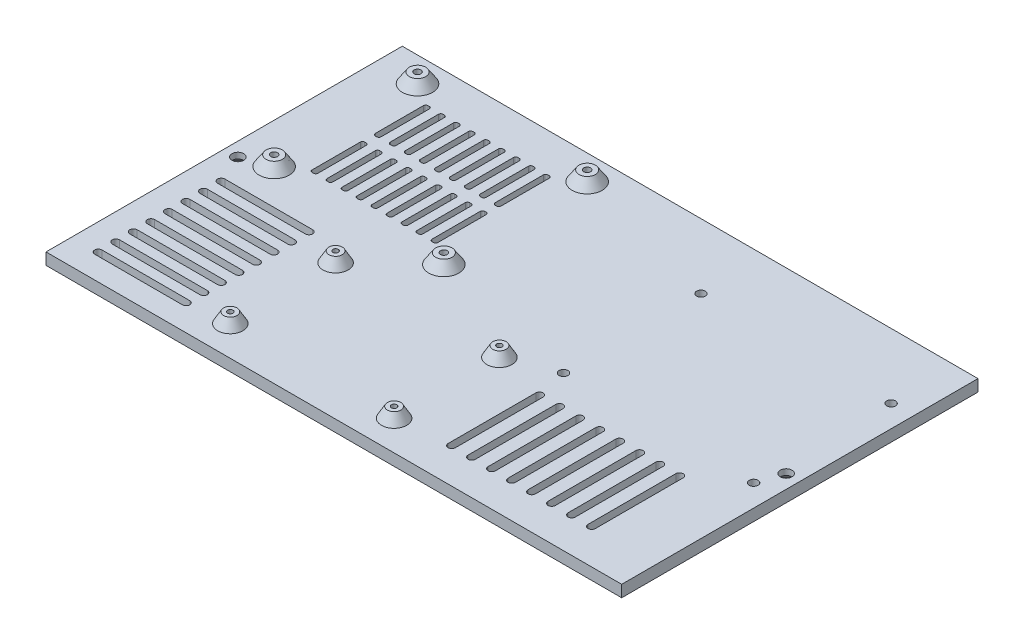
from build123d import *

# Parameters (mm, degrees)
SKETCH1_W                                            = 196.8
SKETCH1_H                                            = 121.8
BOSS_EXTRUDE1_DEPTH                                  = 4
SKETCH2_R                                            = 2
CUT_EXTRUDE1_DEPTH                                   = 116.790198203
CSK_FOR_M4_HEX_SOCKET_COUNTERSUNK_HEAD_S_D           = 4
CSK_FOR_M4_HEX_SOCKET_COUNTERSUNK_HEAD_S_CSINK_D     = 8
CSK_FOR_M4_HEX_SOCKET_COUNTERSUNK_HEAD_S_CSINK_ANGLE = 90
SKETCH6_R                                            = 2.75
BOSS_EXTRUDE3_DEPTH                                  = 3.5
CHAMFER1_SIZE                                        = 2.4
CHAMFER1_SIZE_2                                      = 3.558146324
SKETCH7_R                                            = 1.16
CUT_EXTRUDE2_DEPTH                                   = 6.5
SKETCH8_R                                            = 2.25
BOSS_EXTRUDE4_DEPTH                                  = 3.5
CHAMFER2_SIZE                                        = 2.05
CHAMFER2_SIZE_2                                      = 3.550704156
SKETCH9_R                                            = 0.93
CUT_EXTRUDE3_DEPTH                                   = 6.5
SKETCH10_R                                           = 1.5
CUT_EXTRUDE4_DEPTH                                   = 116.790198203
CUT_EXTRUDE5_DEPTH                                   = 116.790198203
CUT_EXTRUDE6_DEPTH                                   = 116.790198203
CUT_EXTRUDE7_DEPTH                                   = 116.790198203


with BuildPart() as part:
    # Sketch1 → Boss-Extrude1 (new body)
    with BuildSketch(Plane(origin=(0, 0, 0), x_dir=(1, 0, 0), z_dir=(0, 1, 0))):
        Rectangle(SKETCH1_W, SKETCH1_H)
    extrude(amount=BOSS_EXTRUDE1_DEPTH)

    # Sketch2 → Cut-Extrude1 (cut, symmetric)
    with BuildSketch(Plane(origin=(0, 0, 0), x_dir=(-1, 0, 0), z_dir=(0, -1, 0))):
        with Locations(Location((93.7, 0, 0), (0, 0, 90))):
            Circle(SKETCH2_R)
    cut_extrude1 = extrude(amount=CUT_EXTRUDE1_DEPTH, both=True, mode=Mode.SUBTRACT)

    # CSK for M4 Hex Socket Countersunk Head Screw3 (through all)
    with Locations(Plane(origin=(-93.7, 0, 0), x_dir=(0, 0, -1), z_dir=(0, -1, 0))):
        with Locations((0, 0)):
            csk_for_m4_hex_socket_countersunk_head_s = CounterSinkHole(CSK_FOR_M4_HEX_SOCKET_COUNTERSUNK_HEAD_S_D / 2, CSK_FOR_M4_HEX_SOCKET_COUNTERSUNK_HEAD_S_CSINK_D / 2, counter_sink_angle=CSK_FOR_M4_HEX_SOCKET_COUNTERSUNK_HEAD_S_CSINK_ANGLE)

    # Mirror1: Cut-Extrude1, CSK for M4 Hex Socket Countersunk Head Screw3 across plane
    add(cut_extrude1.mirror(Plane(origin=(0, 0, 0), x_dir=(0, 0, 1), z_dir=(1, 0, 0))), mode=Mode.SUBTRACT)
    add(csk_for_m4_hex_socket_countersunk_head_s.mirror(Plane(origin=(0, 0, 0), x_dir=(0, 0, 1), z_dir=(1, 0, 0))), mode=Mode.SUBTRACT)

    # Sketch6 → Boss-Extrude3 (add)
    with BuildSketch(Plane(origin=(0, 4, 0), x_dir=(1, 0, 0), z_dir=(0, 1, 0))):
        with Locations(Location((-26.7, 3.4, 0), (0, 0, 270))):
            Circle(SKETCH6_R)
        with Locations(Location((-84.7, 3.4, 0), (0, 0, 270))):
            Circle(SKETCH6_R)
        with Locations(Location((-26.7, 52.4, 0), (0, 0, 270))):
            Circle(SKETCH6_R)
        with Locations(Location((-84.7, 52.4, 0), (0, 0, 270))):
            Circle(SKETCH6_R)
    extrude(amount=BOSS_EXTRUDE3_DEPTH)

    # Chamfer1
    # the kernel refuses this chamfer: 3.558146324, 2.4 mm, written as the material it adds along each edge
    with BuildSketch(Plane(origin=(-84.7, 4, -52.4), x_dir=(0, 0, 1), z_dir=(-1, 0, 0))) as chamfer1_piece_1_section:
        Polygon((2.75 + CHAMFER1_SIZE, 0), (2.75, CHAMFER1_SIZE_2), (2.75, 0), align=None)
    chamfer1_piece_1 = revolve(axis=Axis((-84.7, 4, -52.4), (0, 1, 0)), mode=Mode.PRIVATE)
    chamfer1_piece_1 = split(chamfer1_piece_1, bisect_by=Plane(origin=(-84.7, 7.5, -56.370171739), z_dir=(0, -1, 0)), keep=Keep.TOP, mode=Mode.PRIVATE)
    add(chamfer1_piece_1)
    with BuildSketch(Plane(origin=(-26.7, 4, -52.4), x_dir=(0, 0, 1), z_dir=(-1, 0, 0))) as chamfer1_piece_2_section:
        Polygon((2.75 + CHAMFER1_SIZE, 0), (2.75, CHAMFER1_SIZE_2), (2.75, 0), align=None)
    chamfer1_piece_2 = revolve(axis=Axis((-26.7, 4, -52.4), (0, 1, 0)), mode=Mode.PRIVATE)
    chamfer1_piece_2 = split(chamfer1_piece_2, bisect_by=Plane(origin=(-26.7, 7.5, -56.370171737), z_dir=(0, -1, 0)), keep=Keep.TOP, mode=Mode.PRIVATE)
    add(chamfer1_piece_2)
    with BuildSketch(Plane(origin=(-84.7, 4, -3.4), x_dir=(0, 0, 1), z_dir=(-1, 0, 0))) as chamfer1_piece_3_section:
        Polygon((2.75 + CHAMFER1_SIZE, 0), (2.75, CHAMFER1_SIZE_2), (2.75, 0), align=None)
    chamfer1_piece_3 = revolve(axis=Axis((-84.7, 4, -3.4), (0, 1, 0)), mode=Mode.PRIVATE)
    chamfer1_piece_3 = split(chamfer1_piece_3, bisect_by=Plane(origin=(-84.7, 7.5, -7.370171739), z_dir=(0, -1, 0)), keep=Keep.TOP, mode=Mode.PRIVATE)
    add(chamfer1_piece_3)
    with BuildSketch(Plane(origin=(-26.7, 4, -3.4), x_dir=(0, 0, 1), z_dir=(-1, 0, 0))) as chamfer1_piece_4_section:
        Polygon((2.75 + CHAMFER1_SIZE, 0), (2.75, CHAMFER1_SIZE_2), (2.75, 0), align=None)
    chamfer1_piece_4 = revolve(axis=Axis((-26.7, 4, -3.4), (0, 1, 0)), mode=Mode.PRIVATE)
    chamfer1_piece_4 = split(chamfer1_piece_4, bisect_by=Plane(origin=(-26.7, 7.5, -7.370171738), z_dir=(0, -1, 0)), keep=Keep.TOP, mode=Mode.PRIVATE)
    add(chamfer1_piece_4)

    # Sketch7 → Cut-Extrude2 (cut)
    with BuildSketch(Plane(origin=(0, 7.5, 0), x_dir=(1, 0, 0), z_dir=(0, 1, 0))):
        with Locations(Location((-26.7, 3.4, 0), (0, 0, 270))):
            Circle(SKETCH7_R)
        with Locations(Location((-26.7, 52.4, 0), (0, 0, 270))):
            Circle(SKETCH7_R)
        with Locations(Location((-84.7, 52.4, 0), (0, 0, 270))):
            Circle(SKETCH7_R)
        with Locations(Location((-84.7, 3.4, 0), (0, 0, 270))):
            Circle(SKETCH7_R)
    extrude(amount=-CUT_EXTRUDE2_DEPTH, mode=Mode.SUBTRACT)

    # Sketch8 → Boss-Extrude4 (add)
    with BuildSketch(Plane(origin=(0, 4, 0), x_dir=(1, 0, 0), z_dir=(0, 1, 0))):
        with Locations(Location((-45.7, -14.6, 0), (0, 0, 270))):
            Circle(SKETCH8_R)
        with Locations(Location((10.3, -14.6, 0), (0, 0, 270))):
            Circle(SKETCH8_R)
        with Locations(Location((10.3, -50.6, 0), (0, 0, 270))):
            Circle(SKETCH8_R)
        with Locations(Location((-45.7, -50.6, 0), (0, 0, 270))):
            Circle(SKETCH8_R)
    extrude(amount=BOSS_EXTRUDE4_DEPTH)

    # Chamfer2
    # the kernel refuses this chamfer: 3.550704156, 2.05 mm, written as the material it adds along each edge
    with BuildSketch(Plane(origin=(10.3, 4, 14.6), x_dir=(0, 0, 1), z_dir=(-1, 0, 0))) as chamfer2_piece_1_section:
        Polygon((2.25 + CHAMFER2_SIZE, 0), (2.25, CHAMFER2_SIZE_2), (2.25, 0), align=None)
    chamfer2_piece_1 = revolve(axis=Axis((10.3, 4, 14.6), (0, 1, 0)), mode=Mode.PRIVATE)
    chamfer2_piece_1 = split(chamfer2_piece_1, bisect_by=Plane(origin=(10.3, 7.5, 11.311409997), z_dir=(0, -1, 0)), keep=Keep.TOP, mode=Mode.PRIVATE)
    add(chamfer2_piece_1)
    with BuildSketch(Plane(origin=(10.3, 4, 50.6), x_dir=(0, 0, 1), z_dir=(-1, 0, 0))) as chamfer2_piece_2_section:
        Polygon((2.25 + CHAMFER2_SIZE, 0), (2.25, CHAMFER2_SIZE_2), (2.25, 0), align=None)
    chamfer2_piece_2 = revolve(axis=Axis((10.3, 4, 50.6), (0, 1, 0)), mode=Mode.PRIVATE)
    chamfer2_piece_2 = split(chamfer2_piece_2, bisect_by=Plane(origin=(10.3, 7.5, 47.311409996), z_dir=(0, -1, 0)), keep=Keep.TOP, mode=Mode.PRIVATE)
    add(chamfer2_piece_2)
    with BuildSketch(Plane(origin=(-45.7, 4, 50.6), x_dir=(0, 0, 1), z_dir=(-1, 0, 0))) as chamfer2_piece_3_section:
        Polygon((2.25 + CHAMFER2_SIZE, 0), (2.25, CHAMFER2_SIZE_2), (2.25, 0), align=None)
    chamfer2_piece_3 = revolve(axis=Axis((-45.7, 4, 50.6), (0, 1, 0)), mode=Mode.PRIVATE)
    chamfer2_piece_3 = split(chamfer2_piece_3, bisect_by=Plane(origin=(-45.7, 7.5, 47.311409996), z_dir=(0, -1, 0)), keep=Keep.TOP, mode=Mode.PRIVATE)
    add(chamfer2_piece_3)
    with BuildSketch(Plane(origin=(-45.7, 4, 14.6), x_dir=(0, 0, 1), z_dir=(-1, 0, 0))) as chamfer2_piece_4_section:
        Polygon((2.25 + CHAMFER2_SIZE, 0), (2.25, CHAMFER2_SIZE_2), (2.25, 0), align=None)
    chamfer2_piece_4 = revolve(axis=Axis((-45.7, 4, 14.6), (0, 1, 0)), mode=Mode.PRIVATE)
    chamfer2_piece_4 = split(chamfer2_piece_4, bisect_by=Plane(origin=(-45.7, 7.5, 11.311409996), z_dir=(0, -1, 0)), keep=Keep.TOP, mode=Mode.PRIVATE)
    add(chamfer2_piece_4)

    # Sketch9 → Cut-Extrude3 (cut)
    with BuildSketch(Plane(origin=(0, 7.5, 0), x_dir=(1, 0, 0), z_dir=(0, 1, 0))):
        with Locations(Location((-45.7, -14.6, 0), (0, 0, 270))):
            Circle(SKETCH9_R)
        with Locations(Location((10.3, -14.6, 0), (0, 0, 270))):
            Circle(SKETCH9_R)
        with Locations(Location((10.3, -50.6, 0), (0, 0, 270))):
            Circle(SKETCH9_R)
        with Locations(Location((-45.7, -50.6, 0), (0, 0, 270))):
            Circle(SKETCH9_R)
    extrude(amount=-CUT_EXTRUDE3_DEPTH, mode=Mode.SUBTRACT)

    # Sketch10 → Cut-Extrude4 (cut, through all)
    with BuildSketch(Plane(origin=(0, 4, 0), x_dir=(1, 0, 0), z_dir=(0, 1, 0))):
        with Locations(Location((25.9, 38.7, 0), (0, 0, 270))):
            Circle(SKETCH10_R)
        with Locations(Location((25.9, -8.3, 0), (0, 0, 270))):
            Circle(SKETCH10_R)
        with Locations(Location((90.9, -8.3, 0), (0, 0, 270))):
            Circle(SKETCH10_R)
        with Locations(Location((90.9, 38.7, 0), (0, 0, 270))):
            Circle(SKETCH10_R)
    extrude(amount=-CUT_EXTRUDE4_DEPTH, mode=Mode.SUBTRACT)

    # Sketch11 → Cut-Extrude5 (cut, through all)
    with BuildSketch(Plane(origin=(0, 4, 0), x_dir=(1, 0, 0), z_dir=(0, 1, 0))):
        with BuildLine():
            Line((-76.45, 47.7), (-75.95, 47.7))
            ThreePointArc((-75.95, 47.7), (-75.419669914, 47.480330086), (-75.2, 46.95))
            Line((-75.2, 46.95), (-75.2, 30.45))
            ThreePointArc((-75.2, 30.45), (-75.419669914, 29.919669914), (-75.95, 29.7))
            Line((-75.95, 29.7), (-76.45, 29.7))
            ThreePointArc((-76.45, 29.7), (-76.980330086, 29.919669914), (-77.2, 30.45))
            Line((-77.2, 30.45), (-77.2, 46.95))
            ThreePointArc((-77.2, 46.95), (-76.980330086, 47.480330086), (-76.45, 47.7))
        make_face()
        with BuildLine():
            Line((-72.075, 46.95), (-72.075, 30.45))
            ThreePointArc((-72.075, 30.45), (-71.855330086, 29.919669914), (-71.325, 29.7))
            Line((-71.325, 29.7), (-70.825, 29.7))
            ThreePointArc((-70.825, 29.7), (-70.294669914, 29.919669914), (-70.075, 30.45))
            Line((-70.075, 30.45), (-70.075, 46.95))
            ThreePointArc((-70.075, 46.95), (-70.294669914, 47.480330086), (-70.825, 47.7))
            Line((-70.825, 47.7), (-71.325, 47.7))
            ThreePointArc((-71.325, 47.7), (-71.855330086, 47.480330086), (-72.075, 46.95))
        make_face()
        with BuildLine():
            Line((-66.95, 46.95), (-66.95, 30.45))
            ThreePointArc((-66.95, 30.45), (-66.730330086, 29.919669914), (-66.2, 29.7))
            Line((-66.2, 29.7), (-65.7, 29.7))
            ThreePointArc((-65.7, 29.7), (-65.169669914, 29.919669914), (-64.95, 30.45))
            Line((-64.95, 30.45), (-64.95, 46.95))
            ThreePointArc((-64.95, 46.95), (-65.169669914, 47.480330086), (-65.7, 47.7))
            Line((-65.7, 47.7), (-66.2, 47.7))
            ThreePointArc((-66.2, 47.7), (-66.730330086, 47.480330086), (-66.95, 46.95))
        make_face()
        with BuildLine():
            Line((-61.825, 46.95), (-61.825, 30.45))
            ThreePointArc((-61.825, 30.45), (-61.605330086, 29.919669914), (-61.075, 29.7))
            Line((-61.075, 29.7), (-60.575, 29.7))
            ThreePointArc((-60.575, 29.7), (-60.044669914, 29.919669914), (-59.825, 30.45))
            Line((-59.825, 30.45), (-59.825, 46.95))
            ThreePointArc((-59.825, 46.95), (-60.044669914, 47.480330086), (-60.575, 47.7))
            Line((-60.575, 47.7), (-61.075, 47.7))
            ThreePointArc((-61.075, 47.7), (-61.605330086, 47.480330086), (-61.825, 46.95))
        make_face()
        with BuildLine():
            Line((-56.7, 46.95), (-56.7, 30.45))
            ThreePointArc((-56.7, 30.45), (-56.480330086, 29.919669914), (-55.95, 29.7))
            Line((-55.95, 29.7), (-55.45, 29.7))
            ThreePointArc((-55.45, 29.7), (-54.919669914, 29.919669914), (-54.7, 30.45))
            Line((-54.7, 30.45), (-54.7, 46.95))
            ThreePointArc((-54.7, 46.95), (-54.919669914, 47.480330086), (-55.45, 47.7))
            Line((-55.45, 47.7), (-55.95, 47.7))
            ThreePointArc((-55.95, 47.7), (-56.480330086, 47.480330086), (-56.7, 46.95))
        make_face()
        with BuildLine():
            Line((-51.575, 46.95), (-51.575, 30.45))
            ThreePointArc((-51.575, 30.45), (-51.355330086, 29.919669914), (-50.825, 29.7))
            Line((-50.825, 29.7), (-50.325, 29.7))
            ThreePointArc((-50.325, 29.7), (-49.794669914, 29.919669914), (-49.575, 30.45))
            Line((-49.575, 30.45), (-49.575, 46.95))
            ThreePointArc((-49.575, 46.95), (-49.794669914, 47.480330086), (-50.325, 47.7))
            Line((-50.325, 47.7), (-50.825, 47.7))
            ThreePointArc((-50.825, 47.7), (-51.355330086, 47.480330086), (-51.575, 46.95))
        make_face()
        with BuildLine():
            Line((-46.45, 46.95), (-46.45, 30.45))
            ThreePointArc((-46.45, 30.45), (-46.230330086, 29.919669914), (-45.7, 29.7))
            Line((-45.7, 29.7), (-45.2, 29.7))
            ThreePointArc((-45.2, 29.7), (-44.669669914, 29.919669914), (-44.45, 30.45))
            Line((-44.45, 30.45), (-44.45, 46.95))
            ThreePointArc((-44.45, 46.95), (-44.669669914, 47.480330086), (-45.2, 47.7))
            Line((-45.2, 47.7), (-45.7, 47.7))
            ThreePointArc((-45.7, 47.7), (-46.230330086, 47.480330086), (-46.45, 46.95))
        make_face()
        with BuildLine():
            Line((-41.325, 46.95), (-41.325, 30.45))
            ThreePointArc((-41.325, 30.45), (-41.105330086, 29.919669914), (-40.575, 29.7))
            Line((-40.575, 29.7), (-40.075, 29.7))
            ThreePointArc((-40.075, 29.7), (-39.544669914, 29.919669914), (-39.325, 30.45))
            Line((-39.325, 30.45), (-39.325, 46.95))
            ThreePointArc((-39.325, 46.95), (-39.544669914, 47.480330086), (-40.075, 47.7))
            Line((-40.075, 47.7), (-40.575, 47.7))
            ThreePointArc((-40.575, 47.7), (-41.105330086, 47.480330086), (-41.325, 46.95))
        make_face()
        with BuildLine():
            Line((-36.2, 46.95), (-36.2, 30.45))
            ThreePointArc((-36.2, 30.45), (-35.980330086, 29.919669914), (-35.45, 29.7))
            Line((-35.45, 29.7), (-34.95, 29.7))
            ThreePointArc((-34.95, 29.7), (-34.419669914, 29.919669914), (-34.2, 30.45))
            Line((-34.2, 30.45), (-34.2, 46.95))
            ThreePointArc((-34.2, 46.95), (-34.419669914, 47.480330086), (-34.95, 47.7))
            Line((-34.95, 47.7), (-35.45, 47.7))
            ThreePointArc((-35.45, 47.7), (-35.980330086, 47.480330086), (-36.2, 46.95))
        make_face()
        with BuildLine():
            Line((-72.075, 25.35), (-72.075, 8.85))
            ThreePointArc((-72.075, 8.85), (-71.855330086, 8.319669914), (-71.325, 8.1))
            Line((-71.325, 8.1), (-70.825, 8.1))
            ThreePointArc((-70.825, 8.1), (-70.294669914, 8.319669914), (-70.075, 8.85))
            Line((-70.075, 8.85), (-70.075, 25.35))
            ThreePointArc((-70.075, 25.35), (-70.294669914, 25.880330086), (-70.825, 26.1))
            Line((-70.825, 26.1), (-71.325, 26.1))
            ThreePointArc((-71.325, 26.1), (-71.855330086, 25.880330086), (-72.075, 25.35))
        make_face()
        with BuildLine():
            Line((-66.95, 25.35), (-66.95, 8.85))
            ThreePointArc((-66.95, 8.85), (-66.730330086, 8.319669914), (-66.2, 8.1))
            Line((-66.2, 8.1), (-65.7, 8.1))
            ThreePointArc((-65.7, 8.1), (-65.169669914, 8.319669914), (-64.95, 8.85))
            Line((-64.95, 8.85), (-64.95, 25.35))
            ThreePointArc((-64.95, 25.35), (-65.169669914, 25.880330086), (-65.7, 26.1))
            Line((-65.7, 26.1), (-66.2, 26.1))
            ThreePointArc((-66.2, 26.1), (-66.730330086, 25.880330086), (-66.95, 25.35))
        make_face()
        with BuildLine():
            Line((-61.825, 25.35), (-61.825, 8.85))
            ThreePointArc((-61.825, 8.85), (-61.605330086, 8.319669914), (-61.075, 8.1))
            Line((-61.075, 8.1), (-60.575, 8.1))
            ThreePointArc((-60.575, 8.1), (-60.044669914, 8.319669914), (-59.825, 8.85))
            Line((-59.825, 8.85), (-59.825, 25.35))
            ThreePointArc((-59.825, 25.35), (-60.044669914, 25.880330086), (-60.575, 26.1))
            Line((-60.575, 26.1), (-61.075, 26.1))
            ThreePointArc((-61.075, 26.1), (-61.605330086, 25.880330086), (-61.825, 25.35))
        make_face()
        with BuildLine():
            Line((-56.7, 25.35), (-56.7, 8.85))
            ThreePointArc((-56.7, 8.85), (-56.480330086, 8.319669914), (-55.95, 8.1))
            Line((-55.95, 8.1), (-55.45, 8.1))
            ThreePointArc((-55.45, 8.1), (-54.919669914, 8.319669914), (-54.7, 8.85))
            Line((-54.7, 8.85), (-54.7, 25.35))
            ThreePointArc((-54.7, 25.35), (-54.919669914, 25.880330086), (-55.45, 26.1))
            Line((-55.45, 26.1), (-55.95, 26.1))
            ThreePointArc((-55.95, 26.1), (-56.480330086, 25.880330086), (-56.7, 25.35))
        make_face()
        with BuildLine():
            Line((-51.575, 25.35), (-51.575, 8.85))
            ThreePointArc((-51.575, 8.85), (-51.355330086, 8.319669914), (-50.825, 8.1))
            Line((-50.825, 8.1), (-50.325, 8.1))
            ThreePointArc((-50.325, 8.1), (-49.794669914, 8.319669914), (-49.575, 8.85))
            Line((-49.575, 8.85), (-49.575, 25.35))
            ThreePointArc((-49.575, 25.35), (-49.794669914, 25.880330086), (-50.325, 26.1))
            Line((-50.325, 26.1), (-50.825, 26.1))
            ThreePointArc((-50.825, 26.1), (-51.355330086, 25.880330086), (-51.575, 25.35))
        make_face()
        with BuildLine():
            Line((-46.45, 25.35), (-46.45, 8.85))
            ThreePointArc((-46.45, 8.85), (-46.230330086, 8.319669914), (-45.7, 8.1))
            Line((-45.7, 8.1), (-45.2, 8.1))
            ThreePointArc((-45.2, 8.1), (-44.669669914, 8.319669914), (-44.45, 8.85))
            Line((-44.45, 8.85), (-44.45, 25.35))
            ThreePointArc((-44.45, 25.35), (-44.669669914, 25.880330086), (-45.2, 26.1))
            Line((-45.2, 26.1), (-45.7, 26.1))
            ThreePointArc((-45.7, 26.1), (-46.230330086, 25.880330086), (-46.45, 25.35))
        make_face()
        with BuildLine():
            Line((-41.325, 25.35), (-41.325, 8.85))
            ThreePointArc((-41.325, 8.85), (-41.105330086, 8.319669914), (-40.575, 8.1))
            Line((-40.575, 8.1), (-40.075, 8.1))
            ThreePointArc((-40.075, 8.1), (-39.544669914, 8.319669914), (-39.325, 8.85))
            Line((-39.325, 8.85), (-39.325, 25.35))
            ThreePointArc((-39.325, 25.35), (-39.544669914, 25.880330086), (-40.075, 26.1))
            Line((-40.075, 26.1), (-40.575, 26.1))
            ThreePointArc((-40.575, 26.1), (-41.105330086, 25.880330086), (-41.325, 25.35))
        make_face()
        with BuildLine():
            Line((-36.2, 25.35), (-36.2, 8.85))
            ThreePointArc((-36.2, 8.85), (-35.980330086, 8.319669914), (-35.45, 8.1))
            Line((-35.45, 8.1), (-34.95, 8.1))
            ThreePointArc((-34.95, 8.1), (-34.419669914, 8.319669914), (-34.2, 8.85))
            Line((-34.2, 8.85), (-34.2, 25.35))
            ThreePointArc((-34.2, 25.35), (-34.419669914, 25.880330086), (-34.95, 26.1))
            Line((-34.95, 26.1), (-35.45, 26.1))
            ThreePointArc((-35.45, 26.1), (-35.980330086, 25.880330086), (-36.2, 25.35))
        make_face()
        with BuildLine():
            Line((-77.2, 25.35), (-77.2, 8.85))
            ThreePointArc((-77.2, 8.85), (-76.980330086, 8.319669914), (-76.45, 8.1))
            Line((-76.45, 8.1), (-75.95, 8.1))
            ThreePointArc((-75.95, 8.1), (-75.419669914, 8.319669914), (-75.2, 8.85))
            Line((-75.2, 8.85), (-75.2, 25.35))
            ThreePointArc((-75.2, 25.35), (-75.419669914, 25.880330086), (-75.95, 26.1))
            Line((-75.95, 26.1), (-76.45, 26.1))
            ThreePointArc((-76.45, 26.1), (-76.980330086, 25.880330086), (-77.2, 25.35))
        make_face()
    extrude(amount=-CUT_EXTRUDE5_DEPTH, mode=Mode.SUBTRACT)

    # Sketch12 → Cut-Extrude6 (cut, through all)
    with BuildSketch(Plane(origin=(0, 4, 0), x_dir=(1, 0, 0), z_dir=(0, 1, 0))):
        with BuildLine():
            Line((-89.4, -8.75), (-59.4, -8.75))
            ThreePointArc((-59.4, -8.75), (-58.15, -10), (-59.4, -11.25))
            Line((-59.4, -11.25), (-89.4, -11.25))
            ThreePointArc((-89.4, -11.25), (-90.65, -10), (-89.4, -8.75))
        make_face()
        with BuildLine():
            Line((-89.4, -17.25), (-59.4, -17.25))
            ThreePointArc((-59.4, -17.25), (-58.15, -16), (-59.4, -14.75))
            Line((-59.4, -14.75), (-89.4, -14.75))
            ThreePointArc((-89.4, -14.75), (-90.65, -16), (-89.4, -17.25))
        make_face()
        with BuildLine():
            Line((-89.4, -23.25), (-59.4, -23.25))
            ThreePointArc((-59.4, -23.25), (-58.15, -22), (-59.4, -20.75))
            Line((-59.4, -20.75), (-89.4, -20.75))
            ThreePointArc((-89.4, -20.75), (-90.65, -22), (-89.4, -23.25))
        make_face()
        with BuildLine():
            Line((-89.4, -29.25), (-59.4, -29.25))
            ThreePointArc((-59.4, -29.25), (-58.15, -28), (-59.4, -26.75))
            Line((-59.4, -26.75), (-89.4, -26.75))
            ThreePointArc((-89.4, -26.75), (-90.65, -28), (-89.4, -29.25))
        make_face()
        with BuildLine():
            Line((-89.4, -35.25), (-59.4, -35.25))
            ThreePointArc((-59.4, -35.25), (-58.15, -34), (-59.4, -32.75))
            Line((-59.4, -32.75), (-89.4, -32.75))
            ThreePointArc((-89.4, -32.75), (-90.65, -34), (-89.4, -35.25))
        make_face()
        with BuildLine():
            Line((-89.4, -41.25), (-59.4, -41.25))
            ThreePointArc((-59.4, -41.25), (-58.15, -40), (-59.4, -38.75))
            Line((-59.4, -38.75), (-89.4, -38.75))
            ThreePointArc((-89.4, -38.75), (-90.65, -40), (-89.4, -41.25))
        make_face()
        with BuildLine():
            Line((-89.4, -47.25), (-59.4, -47.25))
            ThreePointArc((-59.4, -47.25), (-58.15, -46), (-59.4, -44.75))
            Line((-59.4, -44.75), (-89.4, -44.75))
            ThreePointArc((-89.4, -44.75), (-90.65, -46), (-89.4, -47.25))
        make_face()
        with BuildLine():
            Line((-89.4, -53.25), (-59.4, -53.25))
            ThreePointArc((-59.4, -53.25), (-58.15, -52), (-59.4, -50.75))
            Line((-59.4, -50.75), (-89.4, -50.75))
            ThreePointArc((-89.4, -50.75), (-90.65, -52), (-89.4, -53.25))
        make_face()
    extrude(amount=-CUT_EXTRUDE6_DEPTH, mode=Mode.SUBTRACT)

    # Sketch13 → Cut-Extrude7 (cut, through all)
    with BuildSketch(Plane(origin=(0, 4, 0), x_dir=(1, 0, 0), z_dir=(0, 1, 0))):
        with BuildLine():
            Line((29.55, -18.9), (29.55, -48.9))
            ThreePointArc((29.55, -48.9), (28.3, -50.15), (27.05, -48.9))
            Line((27.05, -48.9), (27.05, -18.9))
            ThreePointArc((27.05, -18.9), (28.3, -17.65), (29.55, -18.9))
        make_face()
        with BuildLine():
            Line((33.885714286, -18.9), (33.885714286, -48.9))
            ThreePointArc((33.885714286, -48.9), (35.135714286, -50.15), (36.385714286, -48.9))
            Line((36.385714286, -48.9), (36.385714286, -18.9))
            ThreePointArc((36.385714286, -18.9), (35.135714286, -17.65), (33.885714286, -18.9))
        make_face()
        with BuildLine():
            Line((40.721428571, -18.9), (40.721428571, -48.9))
            ThreePointArc((40.721428571, -48.9), (41.971428571, -50.15), (43.221428571, -48.9))
            Line((43.221428571, -48.9), (43.221428571, -18.9))
            ThreePointArc((43.221428571, -18.9), (41.971428571, -17.65), (40.721428571, -18.9))
        make_face()
        with BuildLine():
            Line((47.557142857, -18.9), (47.557142857, -48.9))
            ThreePointArc((47.557142857, -48.9), (48.807142857, -50.15), (50.057142857, -48.9))
            Line((50.057142857, -48.9), (50.057142857, -18.9))
            ThreePointArc((50.057142857, -18.9), (48.807142857, -17.65), (47.557142857, -18.9))
        make_face()
        with BuildLine():
            Line((54.392857143, -18.9), (54.392857143, -48.9))
            ThreePointArc((54.392857143, -48.9), (55.642857143, -50.15), (56.892857143, -48.9))
            Line((56.892857143, -48.9), (56.892857143, -18.9))
            ThreePointArc((56.892857143, -18.9), (55.642857143, -17.65), (54.392857143, -18.9))
        make_face()
        with BuildLine():
            Line((61.228571429, -18.9), (61.228571429, -48.9))
            ThreePointArc((61.228571429, -48.9), (62.478571429, -50.15), (63.728571429, -48.9))
            Line((63.728571429, -48.9), (63.728571429, -18.9))
            ThreePointArc((63.728571429, -18.9), (62.478571429, -17.65), (61.228571429, -18.9))
        make_face()
        with BuildLine():
            Line((68.064285714, -18.9), (68.064285714, -48.9))
            ThreePointArc((68.064285714, -48.9), (69.314285714, -50.15), (70.564285714, -48.9))
            Line((70.564285714, -48.9), (70.564285714, -18.9))
            ThreePointArc((70.564285714, -18.9), (69.314285714, -17.65), (68.064285714, -18.9))
        make_face()
        with BuildLine():
            Line((74.9, -18.9), (74.9, -48.9))
            ThreePointArc((74.9, -48.9), (76.15, -50.15), (77.4, -48.9))
            Line((77.4, -48.9), (77.4, -18.9))
            ThreePointArc((77.4, -18.9), (76.15, -17.65), (74.9, -18.9))
        make_face()
    extrude(amount=-CUT_EXTRUDE7_DEPTH, mode=Mode.SUBTRACT)


solid = part.part
